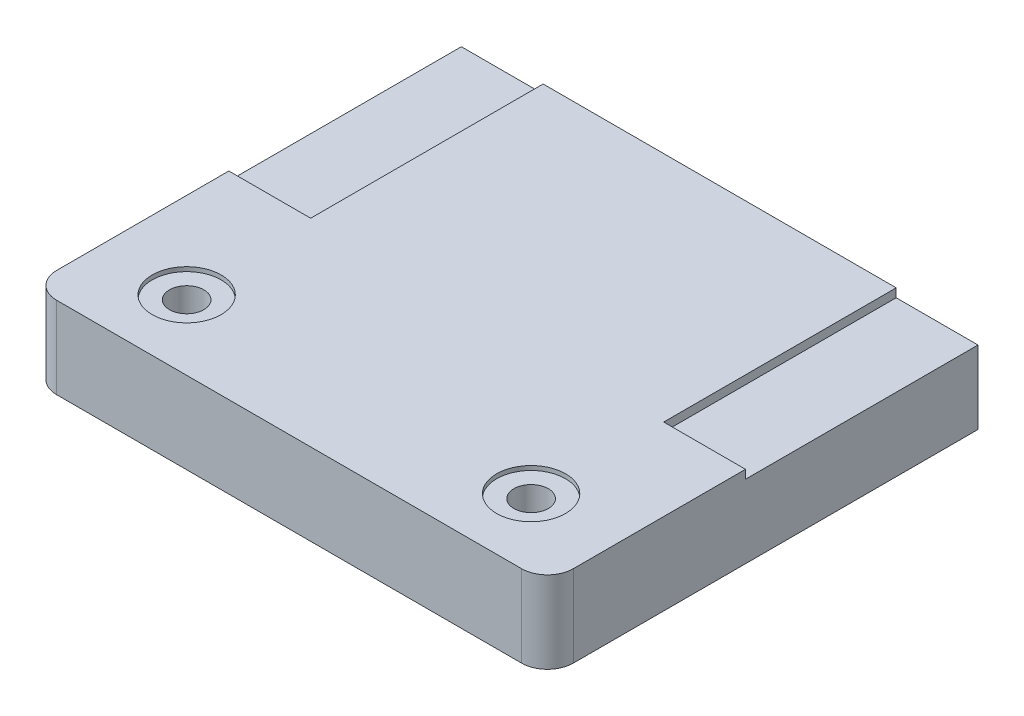
from build123d import *

# Parameters (mm, degrees)
SKETCH_1_W          = 60
SKETCH_1_H          = 50
EXTRUDE_1_DEPTH     = 9.5
FILLET_1_R          = 3
SKETCH_2_R          = 4
CUT_EXTRUDE_1_DEPTH = 0.5
SKETCH_4_W          = 9.5
SKETCH_4_H          = 27
CUT_EXTRUDE_2_DEPTH = 1
SKETCH_5_R          = 2
CUT_EXTRUDE_3_DEPTH = 41.190172928


with BuildPart() as part:
    # 草图1 → 凸台-拉伸1 (new body)
    with BuildSketch(Plane(origin=(0, 0, 0), x_dir=(1, 0, 0), z_dir=(0, 1, 0))):
        Rectangle(SKETCH_1_W, SKETCH_1_H)
    extrude(amount=EXTRUDE_1_DEPTH)

    # 圆角1
    fillet_1_edges = [part.edges().sort_by_distance(p)[0] for p in [
        (-30, 4.75, 25),
        (30, 4.75, 25),
    ]]
    fillet(fillet_1_edges, radius=FILLET_1_R)

    # 草图2 → 切除-拉伸1 (cut)
    with BuildSketch(Plane(origin=(0, 9.5, 0), x_dir=(1, 0, 0), z_dir=(0, 1, 0))):
        with Locations((-20, -16.9)):
            Circle(SKETCH_2_R)
        with Locations((20, -16.9)):
            Circle(SKETCH_2_R)
    extrude(amount=-CUT_EXTRUDE_1_DEPTH, mode=Mode.SUBTRACT)

    # 草图4 → 切除-拉伸2 (cut)
    with BuildSketch(Plane(origin=(0, 9.5, 0), x_dir=(1, 0, 0), z_dir=(0, 1, 0))):
        with Locations((-25.25, 11.5)):
            Rectangle(SKETCH_4_W, SKETCH_4_H)
        with Locations((25.25, 11.5)):
            Rectangle(SKETCH_4_W, SKETCH_4_H)
    extrude(amount=-CUT_EXTRUDE_2_DEPTH, mode=Mode.SUBTRACT)

    # 草图5 → 切除-拉伸3 (cut, through all)
    with BuildSketch(Plane(origin=(0, 9.5, 0), x_dir=(1, 0, 0), z_dir=(0, 1, 0))):
        with Locations((-20, -16.9)):
            Circle(SKETCH_5_R)
        with Locations((20, -16.9)):
            Circle(SKETCH_5_R)
    extrude(amount=-CUT_EXTRUDE_3_DEPTH, mode=Mode.SUBTRACT)


solid = part.part
